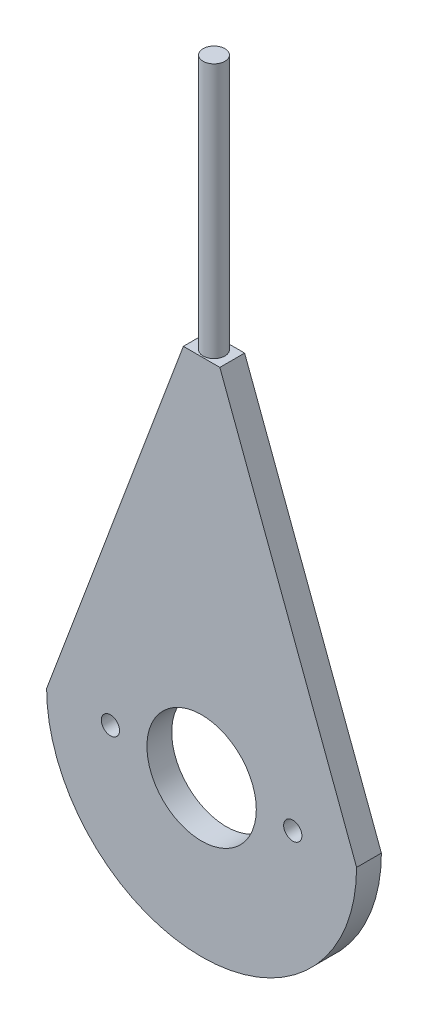
from build123d import *

# Parameters (mm, degrees)
SKETCH1_R           = 15
SKETCH1_R_2         = 2.5
BASE_FLANGE1_DEPTH  = 6.8
SKETCH6_R           = 3
BOSS_EXTRUDE1_DEPTH = 70


# Sheet-metal steps are written as plain solids
with BuildPart() as part:
    # Sketch1 → Base-Flange1 (new body)
    with BuildSketch(Plane.XY):
        with BuildLine():
            Line((-42.5, 0), (-5, 100))
            Line((-5, 100), (5, 100))
            Line((5, 100), (42.5, 0))
            ThreePointArc((42.5, 0), (0, -42.5), (-42.5, 0))
        make_face()
        Circle(SKETCH1_R, mode=Mode.SUBTRACT)
        with Locations((25, 0)):
            Circle(SKETCH1_R_2, mode=Mode.SUBTRACT)
        with Locations(Location((-25, 0, 0), (0, 0, 180))):
            Circle(SKETCH1_R_2, mode=Mode.SUBTRACT)
    extrude(amount=-BASE_FLANGE1_DEPTH)

    # Sketch6 → Boss-Extrude1 (add)
    with BuildSketch(Plane(origin=(0, 100, 0), x_dir=(1, 0, 0), z_dir=(0, 1, 0))):
        with Locations(Location((0, 3.4, 0), (0, 0, 270))):
            Circle(SKETCH6_R)
    extrude(amount=BOSS_EXTRUDE1_DEPTH)


solid = part.part
